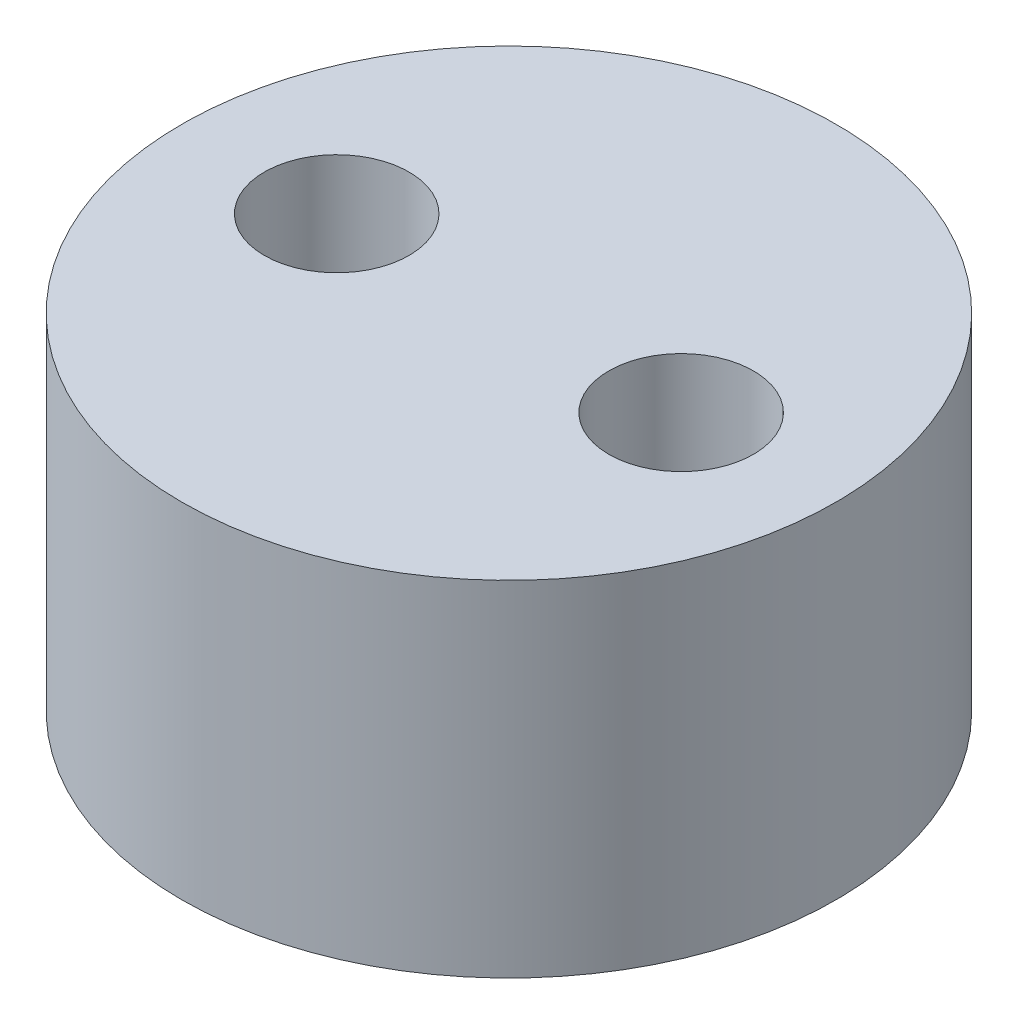
from build123d import *

# Parameters (mm, degrees)
SKETCH1_R           = 9.5
BOSS_EXTRUDE1_DEPTH = 10
SKETCH2_R           = 2.1
CUT_EXTRUDE1_DEPTH  = 17.748134224


with BuildPart() as part:
    # Sketch1 → Boss-Extrude1 (new body)
    with BuildSketch(Plane(origin=(0, 0, 0), x_dir=(1, 0, 0), z_dir=(0, 1, 0))):
        Circle(SKETCH1_R)
    extrude(amount=BOSS_EXTRUDE1_DEPTH)

    # Sketch2 → Cut-Extrude1 (cut, symmetric)
    with BuildSketch(Plane(origin=(0, 10, 0), x_dir=(1, 0, 0), z_dir=(0, 1, 0))):
        with Locations((5, 0)):
            Circle(SKETCH2_R)
    cut_extrude1 = extrude(amount=CUT_EXTRUDE1_DEPTH, both=True, mode=Mode.SUBTRACT)

    # Mirror1: Cut-Extrude1 across plane
    add(cut_extrude1.mirror(Plane(origin=(0, 0, 0), x_dir=(0, 0, 1), z_dir=(1, 0, 0))), mode=Mode.SUBTRACT)


solid = part.part
